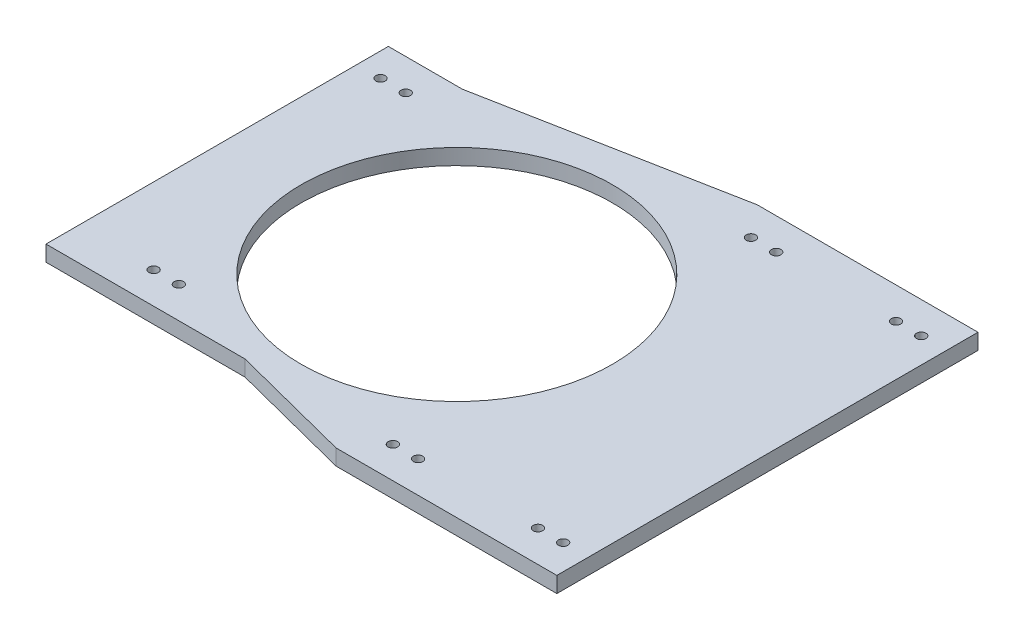
from build123d import *

# Parameters (mm, degrees)
SKETCH1_W             = 262.89
SKETCH1_H             = 169.62374
SKETCH1_R             = 62.6745
BOSS_EXTRUDE1_DEPTH   = 6.35
SKETCH2_W             = 44.45
SKETCH2_H             = 169.62374
CUT_EXTRUDE1_DEPTH    = 157.560415872
CUT_EXTRUDE2_DEPTH    = 157.560415872
F_6_CLEARANCE_HOLE1_D = 3.7973
F_6_CLEARANCE_HOLE2_D = 3.7973
F_6_CLEARANCE_HOLE3_D = 3.7973


with BuildPart() as part:
    # Sketch1 → Boss-Extrude1 (new body)
    with BuildSketch(Plane(origin=(0, 0, 0), x_dir=(1, 0, 0), z_dir=(0, 1, 0))):
        Rectangle(SKETCH1_W, SKETCH1_H)
        with Locations((6.35, 0)):
            Circle(SKETCH1_R, mode=Mode.SUBTRACT)
    extrude(amount=BOSS_EXTRUDE1_DEPTH)

    # Sketch2 → Cut-Extrude1 (cut, through all)
    with BuildSketch(Plane.XZ):
        with Locations((-109.22, 0)):
            Rectangle(SKETCH2_W, SKETCH2_H)
    extrude(amount=-CUT_EXTRUDE1_DEPTH, mode=Mode.SUBTRACT)

    # Sketch3 → Cut-Extrude2 (cut, through all)
    with BuildSketch(Plane.XZ):
        Polygon((42.545, -84.81187), (-57.11698, -65.76187), (-86.995, -65.76187), (-86.995, -84.81187), align=None)
        Polygon((42.545, 84.81187), (-6.82498, 72.11187), (-86.995, 72.11187), (-86.995, 84.81187), align=None)
    extrude(amount=-CUT_EXTRUDE2_DEPTH, mode=Mode.SUBTRACT)

    # #6 Clearance Hole1 (through all)
    with Locations(Plane(origin=(0, 0, 0), x_dir=(-1, 0, 0), z_dir=(0, -1, 0))):
        with Locations((-121.285, 72.11187), (-111.125, 72.11187), (-62.865, 72.11187), (-52.705, 72.11187)):
            f_6_clearance_hole1 = Hole(F_6_CLEARANCE_HOLE1_D / 2)

    # Mirror1: #6 Clearance Hole1 across plane
    add(f_6_clearance_hole1.mirror(Plane.XY), mode=Mode.SUBTRACT)

    # #6 Clearance Hole2 (through all)
    with Locations(Plane(origin=(0, 6.35, 0), x_dir=(1, 0, 0), z_dir=(0, 1, 0))):
        with Locations((-67.27698, 53.06187), (-77.43698, 53.06187)):
            Hole(F_6_CLEARANCE_HOLE2_D / 2)

    # #6 Clearance Hole3 (through all)
    with Locations(Plane(origin=(0, 6.35, 0), x_dir=(1, 0, 0), z_dir=(0, 1, 0))):
        with Locations((-46.19498, -59.41187), (-56.35498, -59.41187)):
            Hole(F_6_CLEARANCE_HOLE3_D / 2)


solid = part.part
